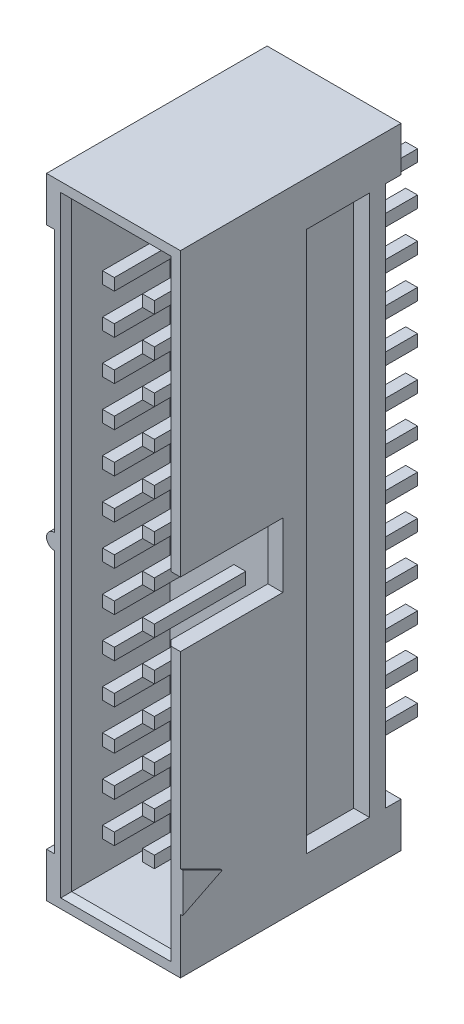
from build123d import *

# Parameters (mm, degrees)
SKETCH1_W            = 39.98
SKETCH1_H            = 13
BOSS_EXTRUDE1_DEPTH  = 8.5
SKETCH2_W            = 0.5
SKETCH2_H            = 37.15
CUT_EXTRUDE1_DEPTH   = 25.247888568
SKETCH3_W            = 8.5
SKETCH3_H            = 2.83
BOSS_EXTRUDE2_DEPTH  = 1
SKETCH4_W            = 13
SKETCH4_H            = 2.83
BOSS_EXTRUDE3_DEPTH  = 0.5
SKETCH5_W            = 8.5
SKETCH5_H            = 2.83
BOSS_EXTRUDE4_DEPTH  = 1
BOSS_EXTRUDE5_DEPTH  = 8.1
SKETCH7_W            = 4.9
SKETCH7_H            = 34.32
CUT_EXTRUDE2_DEPTH   = 0.5
SKETCH8_W            = 6.5
SKETCH8_H            = 34.1
BOSS_EXTRUDE6_DEPTH  = 1
SKETCH9_W            = 0.5
SKETCH9_H            = 0.04
CUT_EXTRUDE3_DEPTH   = 6.5
SKETCH10_W           = 0.5
SKETCH10_H           = 1.54
CUT_EXTRUDE4_DEPTH   = 26.531355232
SKETCH11_W           = 0.5
SKETCH11_H           = 1.54
CUT_EXTRUDE5_DEPTH   = 26.531355232
SKETCH12_W           = 0.5
SKETCH12_H           = 1.54
CUT_EXTRUDE6_DEPTH   = 26.531355232
SKETCH13_W           = 0.5
SKETCH13_H           = 1.54
CUT_EXTRUDE7_DEPTH   = 26.531355232
SKETCH14_W           = 0.5
SKETCH14_H           = 1.54
CUT_EXTRUDE8_DEPTH   = 26.531355232
SKETCH15_W           = 0.5
SKETCH15_H           = 1.54
CUT_EXTRUDE9_DEPTH   = 26.531355232
SKETCH16_W           = 0.5
SKETCH16_H           = 1.54
CUT_EXTRUDE10_DEPTH  = 26.531355232
SKETCH17_W           = 0.5
SKETCH17_H           = 1.54
CUT_EXTRUDE11_DEPTH  = 26.531355232
SKETCH18_W           = 0.5
SKETCH18_H           = 1.54
CUT_EXTRUDE12_DEPTH  = 26.531355232
SKETCH19_W           = 0.5
SKETCH19_H           = 1.54
CUT_EXTRUDE13_DEPTH  = 26.531355232
SKETCH20_W           = 0.5
SKETCH20_H           = 1.54
CUT_EXTRUDE14_DEPTH  = 26.531355232
SKETCH21_W           = 0.5
SKETCH21_H           = 1.54
CUT_EXTRUDE15_DEPTH  = 26.531355232
SKETCH22_W           = 0.5
SKETCH22_H           = 1.54
CUT_EXTRUDE16_DEPTH  = 26.531355232
SKETCH23_W           = 0.5
SKETCH23_H           = 0.04
CUT_EXTRUDE17_DEPTH  = 6.5
SKETCH24_W           = 6.3
SKETCH24_H           = 38.08
CUT_EXTRUDE18_DEPTH  = 6.6
CUT_EXTRUDE19_REACH  = 27.843
SKETCH25_W           = 6.5
SKETCH25_H           = 4.1
BOSS_EXTRUDE7_DEPTH  = 0.15
SKETCH27_W           = 0.75
SKETCH27_H           = 0.75
BOSS_EXTRUDE8_DEPTH  = 4
SKETCH28_W           = 0.75
SKETCH28_H           = 0.75
BOSS_EXTRUDE9_DEPTH  = 4
SKETCH29_W           = 0.75
SKETCH29_H           = 0.75
BOSS_EXTRUDE10_DEPTH = 4
SKETCH30_W           = 0.75
SKETCH30_H           = 0.75
BOSS_EXTRUDE11_DEPTH = 4
SKETCH31_W           = 0.75
SKETCH31_H           = 0.75
BOSS_EXTRUDE12_DEPTH = 4
SKETCH32_W           = 0.75
SKETCH32_H           = 0.75
BOSS_EXTRUDE13_DEPTH = 4
SKETCH33_W           = 0.75
SKETCH33_H           = 0.75
BOSS_EXTRUDE14_DEPTH = 4
SKETCH34_W           = 0.75
SKETCH34_H           = 0.75
BOSS_EXTRUDE15_DEPTH = 4
SKETCH35_W           = 0.75
SKETCH35_H           = 0.75
BOSS_EXTRUDE16_DEPTH = 4
SKETCH36_W           = 0.75
SKETCH36_H           = 0.75
BOSS_EXTRUDE17_DEPTH = 4
SKETCH37_W           = 0.75
SKETCH37_H           = 0.75
BOSS_EXTRUDE18_DEPTH = 4
SKETCH38_W           = 0.75
SKETCH38_H           = 0.75
BOSS_EXTRUDE19_DEPTH = 4
SKETCH39_W           = 0.75
SKETCH39_H           = 0.75
BOSS_EXTRUDE20_DEPTH = 4
SKETCH40_W           = 0.75
SKETCH40_H           = 0.75
BOSS_EXTRUDE21_DEPTH = 4
SKETCH41_W           = 0.75
SKETCH41_H           = 0.75
BOSS_EXTRUDE22_DEPTH = 4
SKETCH42_W           = 0.75
SKETCH42_H           = 0.75
BOSS_EXTRUDE23_DEPTH = 4
SKETCH43_W           = 0.75
SKETCH43_H           = 0.75
BOSS_EXTRUDE24_DEPTH = 4
SKETCH44_W           = 0.75
SKETCH44_H           = 0.75
BOSS_EXTRUDE25_DEPTH = 4
SKETCH45_W           = 0.75
SKETCH45_H           = 0.75
BOSS_EXTRUDE26_DEPTH = 4
SKETCH46_W           = 0.75
SKETCH46_H           = 0.75
BOSS_EXTRUDE27_DEPTH = 4
SKETCH47_W           = 0.75
SKETCH47_H           = 0.75
BOSS_EXTRUDE28_DEPTH = 4
SKETCH48_W           = 0.75
SKETCH48_H           = 0.75
BOSS_EXTRUDE29_DEPTH = 4
SKETCH49_W           = 0.75
SKETCH49_H           = 0.75
BOSS_EXTRUDE30_DEPTH = 4
SKETCH50_W           = 0.75
SKETCH50_H           = 0.75
BOSS_EXTRUDE31_DEPTH = 4
SKETCH51_W           = 0.75
SKETCH51_H           = 0.75
BOSS_EXTRUDE32_DEPTH = 4
SKETCH52_W           = 0.75
SKETCH52_H           = 0.75
BOSS_EXTRUDE33_DEPTH = 4
SKETCH53_W           = 0.75
SKETCH53_H           = 0.75
BOSS_EXTRUDE34_DEPTH = 5.8
SKETCH54_W           = 0.75
SKETCH54_H           = 0.75
BOSS_EXTRUDE35_DEPTH = 5.8
SKETCH55_W           = 0.75
SKETCH55_H           = 0.75
BOSS_EXTRUDE36_DEPTH = 5.8
SKETCH56_W           = 0.75
SKETCH56_H           = 0.75
BOSS_EXTRUDE37_DEPTH = 5.8
SKETCH57_W           = 0.75
SKETCH57_H           = 0.75
BOSS_EXTRUDE38_DEPTH = 5.8
SKETCH58_W           = 0.75
SKETCH58_H           = 0.75
BOSS_EXTRUDE39_DEPTH = 5.8
SKETCH59_W           = 0.75
SKETCH59_H           = 0.75
BOSS_EXTRUDE40_DEPTH = 5.8
SKETCH60_W           = 0.75
SKETCH60_H           = 0.75
BOSS_EXTRUDE41_DEPTH = 5.8
SKETCH61_W           = 0.75
SKETCH61_H           = 0.75
BOSS_EXTRUDE42_DEPTH = 5.8
SKETCH62_W           = 0.75
SKETCH62_H           = 0.75
BOSS_EXTRUDE43_DEPTH = 5.8
SKETCH63_W           = 0.75
SKETCH63_H           = 0.75
BOSS_EXTRUDE44_DEPTH = 5.8
SKETCH64_W           = 0.75
SKETCH64_H           = 0.75
BOSS_EXTRUDE45_DEPTH = 5.8
SKETCH65_W           = 0.75
SKETCH65_H           = 0.75
BOSS_EXTRUDE46_DEPTH = 5.8
SKETCH66_W           = 0.75
SKETCH66_H           = 0.75
BOSS_EXTRUDE47_DEPTH = 5.8
SKETCH67_W           = 0.75
SKETCH67_H           = 0.75
BOSS_EXTRUDE48_DEPTH = 5.8
SKETCH68_W           = 0.75
SKETCH68_H           = 0.75
BOSS_EXTRUDE49_DEPTH = 5.8
SKETCH69_W           = 0.75
SKETCH69_H           = 0.75
BOSS_EXTRUDE50_DEPTH = 5.8
SKETCH70_W           = 0.75
SKETCH70_H           = 0.75
BOSS_EXTRUDE51_DEPTH = 5.8
SKETCH71_W           = 0.75
SKETCH71_H           = 0.75
BOSS_EXTRUDE52_DEPTH = 5.8
SKETCH72_W           = 0.75
SKETCH72_H           = 0.75
BOSS_EXTRUDE53_DEPTH = 5.8
SKETCH73_W           = 0.75
SKETCH73_H           = 0.75
BOSS_EXTRUDE54_DEPTH = 5.8
SKETCH74_W           = 0.75
SKETCH74_H           = 0.75
BOSS_EXTRUDE55_DEPTH = 5.8
SKETCH75_W           = 0.75
SKETCH75_H           = 0.75
BOSS_EXTRUDE56_DEPTH = 5.8
SKETCH76_W           = 0.75
SKETCH76_H           = 0.75
BOSS_EXTRUDE57_DEPTH = 5.8
SKETCH77_W           = 0.75
SKETCH77_H           = 0.75
BOSS_EXTRUDE58_DEPTH = 5.8
SKETCH78_W           = 0.75
SKETCH78_H           = 0.75
BOSS_EXTRUDE59_DEPTH = 5.8
SKETCH79_W           = 4
SKETCH79_H           = 34.32
CUT_EXTRUDE20_DEPTH  = 1
CHAMFER1_SIZE        = 0.35


with BuildPart() as part:
    # Sketch1 → Boss-Extrude1 (new body)
    with BuildSketch(Plane(origin=(-4.4, 0, 0), x_dir=(0, -1, 0), z_dir=(-1, 0, 0))):
        with Locations((0, 7.5)):
            Rectangle(SKETCH1_W, SKETCH1_H)
    extrude(amount=-BOSS_EXTRUDE1_DEPTH)

    # Sketch2 → Cut-Extrude1 (cut, through all)
    with BuildSketch(Plane.XY.offset(14)):
        with Locations((-4.15, -1.415)):
            Rectangle(SKETCH2_W, SKETCH2_H)
    extrude(amount=-CUT_EXTRUDE1_DEPTH, mode=Mode.SUBTRACT)

    # Sketch3 → Boss-Extrude2 (add)
    with BuildSketch(Plane(origin=(0, 0, 1), x_dir=(-1, 0, 0), z_dir=(0, 0, -1))):
        with Locations((0.15, 18.575)):
            Rectangle(SKETCH3_W, SKETCH3_H)
    extrude(amount=BOSS_EXTRUDE2_DEPTH)

    # Sketch4 → Boss-Extrude3 (add)
    with BuildSketch(Plane.ZY.offset(3.9)):
        with Locations((7.5, -18.575)):
            Rectangle(SKETCH4_W, SKETCH4_H)
    extrude(amount=BOSS_EXTRUDE3_DEPTH)

    # Sketch5 → Boss-Extrude4 (add)
    with BuildSketch(Plane(origin=(0, 0, 1), x_dir=(-1, 0, 0), z_dir=(0, 0, -1))):
        with Locations((0.15, -18.575)):
            Rectangle(SKETCH5_W, SKETCH5_H)
    extrude(amount=BOSS_EXTRUDE4_DEPTH)

    # Sketch6 → Boss-Extrude5 (add)
    with BuildSketch(Plane.XY.offset(14)):
        with BuildLine():
            Line((-3.9, -0.5), (-3.9, 0.5))
            ThreePointArc((-3.9, 0.5), (-4.4, 0), (-3.9, -0.5))
        make_face()
    extrude(amount=-BOSS_EXTRUDE5_DEPTH)

    # Sketch7 → Cut-Extrude2 (cut)
    with BuildSketch(Plane.ZY.offset(3.9)):
        with Locations((3.45, 0)):
            Rectangle(SKETCH7_W, SKETCH7_H)
    extrude(amount=-CUT_EXTRUDE2_DEPTH, mode=Mode.SUBTRACT)

    # Sketch8 → Boss-Extrude6 (add)
    with BuildSketch(Plane(origin=(0, 0, 1), x_dir=(-1, 0, 0), z_dir=(0, 0, -1))):
        with Locations((0.15, 0)):
            Rectangle(SKETCH8_W, SKETCH8_H)
    extrude(amount=BOSS_EXTRUDE6_DEPTH)

    # Sketch9 → Cut-Extrude3 (cut)
    with BuildSketch(Plane.ZY.offset(3.4)):
        with Locations((0.25, -17.03)):
            Rectangle(SKETCH9_W, SKETCH9_H)
    extrude(amount=-CUT_EXTRUDE3_DEPTH, mode=Mode.SUBTRACT)

    # Sketch10 → Cut-Extrude4 (cut, through all)
    with BuildSketch(Plane.ZY.offset(3.4)):
        with Locations((0.25, -15.24)):
            Rectangle(SKETCH10_W, SKETCH10_H)
    extrude(amount=-CUT_EXTRUDE4_DEPTH, mode=Mode.SUBTRACT)

    # Sketch11 → Cut-Extrude5 (cut, through all)
    with BuildSketch(Plane.ZY.offset(3.4)):
        with Locations((0.25, -12.7)):
            Rectangle(SKETCH11_W, SKETCH11_H)
    extrude(amount=-CUT_EXTRUDE5_DEPTH, mode=Mode.SUBTRACT)

    # Sketch12 → Cut-Extrude6 (cut, through all)
    with BuildSketch(Plane.ZY.offset(3.4)):
        with Locations((0.25, -10.16)):
            Rectangle(SKETCH12_W, SKETCH12_H)
    extrude(amount=-CUT_EXTRUDE6_DEPTH, mode=Mode.SUBTRACT)

    # Sketch13 → Cut-Extrude7 (cut, through all)
    with BuildSketch(Plane.ZY.offset(3.4)):
        with Locations((0.25, -7.62)):
            Rectangle(SKETCH13_W, SKETCH13_H)
    extrude(amount=-CUT_EXTRUDE7_DEPTH, mode=Mode.SUBTRACT)

    # Sketch14 → Cut-Extrude8 (cut, through all)
    with BuildSketch(Plane.ZY.offset(3.4)):
        with Locations((0.25, -5.08)):
            Rectangle(SKETCH14_W, SKETCH14_H)
    extrude(amount=-CUT_EXTRUDE8_DEPTH, mode=Mode.SUBTRACT)

    # Sketch15 → Cut-Extrude9 (cut, through all)
    with BuildSketch(Plane.ZY.offset(3.4)):
        with Locations((0.25, -2.54)):
            Rectangle(SKETCH15_W, SKETCH15_H)
    extrude(amount=-CUT_EXTRUDE9_DEPTH, mode=Mode.SUBTRACT)

    # Sketch16 → Cut-Extrude10 (cut, through all)
    with BuildSketch(Plane.ZY.offset(3.4)):
        with Locations((0.25, 0)):
            Rectangle(SKETCH16_W, SKETCH16_H)
    extrude(amount=-CUT_EXTRUDE10_DEPTH, mode=Mode.SUBTRACT)

    # Sketch17 → Cut-Extrude11 (cut, through all)
    with BuildSketch(Plane.ZY.offset(3.4)):
        with Locations((0.25, 2.54)):
            Rectangle(SKETCH17_W, SKETCH17_H)
    extrude(amount=-CUT_EXTRUDE11_DEPTH, mode=Mode.SUBTRACT)

    # Sketch18 → Cut-Extrude12 (cut, through all)
    with BuildSketch(Plane.ZY.offset(3.4)):
        with Locations((0.25, 5.08)):
            Rectangle(SKETCH18_W, SKETCH18_H)
    extrude(amount=-CUT_EXTRUDE12_DEPTH, mode=Mode.SUBTRACT)

    # Sketch19 → Cut-Extrude13 (cut, through all)
    with BuildSketch(Plane.ZY.offset(3.4)):
        with Locations((0.25, 7.62)):
            Rectangle(SKETCH19_W, SKETCH19_H)
    extrude(amount=-CUT_EXTRUDE13_DEPTH, mode=Mode.SUBTRACT)

    # Sketch20 → Cut-Extrude14 (cut, through all)
    with BuildSketch(Plane.ZY.offset(3.4)):
        with Locations((0.25, 10.16)):
            Rectangle(SKETCH20_W, SKETCH20_H)
    extrude(amount=-CUT_EXTRUDE14_DEPTH, mode=Mode.SUBTRACT)

    # Sketch21 → Cut-Extrude15 (cut, through all)
    with BuildSketch(Plane.ZY.offset(3.4)):
        with Locations((0.25, 12.7)):
            Rectangle(SKETCH21_W, SKETCH21_H)
    extrude(amount=-CUT_EXTRUDE15_DEPTH, mode=Mode.SUBTRACT)

    # Sketch22 → Cut-Extrude16 (cut, through all)
    with BuildSketch(Plane.ZY.offset(3.4)):
        with Locations((0.25, 15.24)):
            Rectangle(SKETCH22_W, SKETCH22_H)
    extrude(amount=-CUT_EXTRUDE16_DEPTH, mode=Mode.SUBTRACT)

    # Sketch23 → Cut-Extrude17 (cut)
    with BuildSketch(Plane.ZY.offset(3.4)):
        with Locations((0.25, 17.03)):
            Rectangle(SKETCH23_W, SKETCH23_H)
    extrude(amount=-CUT_EXTRUDE17_DEPTH, mode=Mode.SUBTRACT)

    # Sketch24 → Cut-Extrude18 (cut)
    with BuildSketch(Plane.XY.offset(14)):
        Rectangle(SKETCH24_W, SKETCH24_H)
    extrude(amount=-CUT_EXTRUDE18_DEPTH, mode=Mode.SUBTRACT)

    # Sketch25 → Cut-Extrude19 (cut, up to next)
    with BuildSketch(Plane(origin=(4.1, 0, 0), x_dir=(0, 0, -1), z_dir=(1, 0, 0)), mode=Mode.PRIVATE) as cut_extrude19_sk1:
        with Locations((-10.75, 0)):
            Rectangle(SKETCH25_W, SKETCH25_H)
    cut_extrude19_tool1 = extrude(cut_extrude19_sk1.sketch, amount=-CUT_EXTRUDE19_REACH, mode=Mode.PRIVATE) & part.part
    add(cut_extrude19_tool1.solids().sort_by_distance((4.1, 0, 10.75))[0], mode=Mode.SUBTRACT)

    # Sketch26 → Boss-Extrude7 (add)
    with BuildSketch(Plane(origin=(4.1, 0, 0), x_dir=(0, 0, -1), z_dir=(1, 0, 0))):
        Polygon((-14, -13.99), (-11.5, -15.24), (-14, -16.49), align=None)
    extrude(amount=BOSS_EXTRUDE7_DEPTH)

    # Sketch27 → Boss-Extrude8 (add)
    with BuildSketch(Plane(origin=(0, 0, 0.5), x_dir=(-1, 0, 0), z_dir=(0, 0, -1))):
        with Locations((-1.27, 0)):
            Rectangle(SKETCH27_W, SKETCH27_H)
    extrude(amount=BOSS_EXTRUDE8_DEPTH)

    # Sketch28 → Boss-Extrude9 (add)
    with BuildSketch(Plane(origin=(0, 0, 0.5), x_dir=(-1, 0, 0), z_dir=(0, 0, -1))):
        with Locations((1.27, 0)):
            Rectangle(SKETCH28_W, SKETCH28_H)
    extrude(amount=BOSS_EXTRUDE9_DEPTH)

    # Sketch29 → Boss-Extrude10 (add)
    with BuildSketch(Plane(origin=(0, 0, 0.5), x_dir=(-1, 0, 0), z_dir=(0, 0, -1))):
        with Locations((-1.27, -2.54)):
            Rectangle(SKETCH29_W, SKETCH29_H)
    extrude(amount=BOSS_EXTRUDE10_DEPTH)

    # Sketch30 → Boss-Extrude11 (add)
    with BuildSketch(Plane(origin=(0, 0, 0.5), x_dir=(-1, 0, 0), z_dir=(0, 0, -1))):
        with Locations((1.27, -2.54)):
            Rectangle(SKETCH30_W, SKETCH30_H)
    extrude(amount=BOSS_EXTRUDE11_DEPTH)

    # Sketch31 → Boss-Extrude12 (add)
    with BuildSketch(Plane(origin=(0, 0, 0.5), x_dir=(-1, 0, 0), z_dir=(0, 0, -1))):
        with Locations((-1.27, 2.54)):
            Rectangle(SKETCH31_W, SKETCH31_H)
    extrude(amount=BOSS_EXTRUDE12_DEPTH)

    # Sketch32 → Boss-Extrude13 (add)
    with BuildSketch(Plane(origin=(0, 0, 0.5), x_dir=(-1, 0, 0), z_dir=(0, 0, -1))):
        with Locations((1.27, 2.54)):
            Rectangle(SKETCH32_W, SKETCH32_H)
    extrude(amount=BOSS_EXTRUDE13_DEPTH)

    # Sketch33 → Boss-Extrude14 (add)
    with BuildSketch(Plane(origin=(0, 0, 0.5), x_dir=(-1, 0, 0), z_dir=(0, 0, -1))):
        with Locations((-1.27, -5.08)):
            Rectangle(SKETCH33_W, SKETCH33_H)
    extrude(amount=BOSS_EXTRUDE14_DEPTH)

    # Sketch34 → Boss-Extrude15 (add)
    with BuildSketch(Plane(origin=(0, 0, 0.5), x_dir=(-1, 0, 0), z_dir=(0, 0, -1))):
        with Locations((1.27, -5.08)):
            Rectangle(SKETCH34_W, SKETCH34_H)
    extrude(amount=BOSS_EXTRUDE15_DEPTH)

    # Sketch35 → Boss-Extrude16 (add)
    with BuildSketch(Plane(origin=(0, 0, 0.5), x_dir=(-1, 0, 0), z_dir=(0, 0, -1))):
        with Locations((-1.27, 5.08)):
            Rectangle(SKETCH35_W, SKETCH35_H)
    extrude(amount=BOSS_EXTRUDE16_DEPTH)

    # Sketch36 → Boss-Extrude17 (add)
    with BuildSketch(Plane(origin=(0, 0, 0.5), x_dir=(-1, 0, 0), z_dir=(0, 0, -1))):
        with Locations((1.27, 5.08)):
            Rectangle(SKETCH36_W, SKETCH36_H)
    extrude(amount=BOSS_EXTRUDE17_DEPTH)

    # Sketch37 → Boss-Extrude18 (add)
    with BuildSketch(Plane(origin=(0, 0, 0.5), x_dir=(-1, 0, 0), z_dir=(0, 0, -1))):
        with Locations((-1.27, -7.62)):
            Rectangle(SKETCH37_W, SKETCH37_H)
    extrude(amount=BOSS_EXTRUDE18_DEPTH)

    # Sketch38 → Boss-Extrude19 (add)
    with BuildSketch(Plane(origin=(0, 0, 0.5), x_dir=(-1, 0, 0), z_dir=(0, 0, -1))):
        with Locations((1.27, -7.62)):
            Rectangle(SKETCH38_W, SKETCH38_H)
    extrude(amount=BOSS_EXTRUDE19_DEPTH)

    # Sketch39 → Boss-Extrude20 (add)
    with BuildSketch(Plane(origin=(0, 0, 0.5), x_dir=(-1, 0, 0), z_dir=(0, 0, -1))):
        with Locations((-1.27, 7.62)):
            Rectangle(SKETCH39_W, SKETCH39_H)
    extrude(amount=BOSS_EXTRUDE20_DEPTH)

    # Sketch40 → Boss-Extrude21 (add)
    with BuildSketch(Plane(origin=(0, 0, 0.5), x_dir=(-1, 0, 0), z_dir=(0, 0, -1))):
        with Locations((1.27, 7.62)):
            Rectangle(SKETCH40_W, SKETCH40_H)
    extrude(amount=BOSS_EXTRUDE21_DEPTH)

    # Sketch41 → Boss-Extrude22 (add)
    with BuildSketch(Plane(origin=(0, 0, 0.5), x_dir=(-1, 0, 0), z_dir=(0, 0, -1))):
        with Locations((-1.27, -10.16)):
            Rectangle(SKETCH41_W, SKETCH41_H)
    extrude(amount=BOSS_EXTRUDE22_DEPTH)

    # Sketch42 → Boss-Extrude23 (add)
    with BuildSketch(Plane(origin=(0, 0, 0.5), x_dir=(-1, 0, 0), z_dir=(0, 0, -1))):
        with Locations((1.27, -10.16)):
            Rectangle(SKETCH42_W, SKETCH42_H)
    extrude(amount=BOSS_EXTRUDE23_DEPTH)

    # Sketch43 → Boss-Extrude24 (add)
    with BuildSketch(Plane(origin=(0, 0, 0.5), x_dir=(-1, 0, 0), z_dir=(0, 0, -1))):
        with Locations((-1.27, 10.16)):
            Rectangle(SKETCH43_W, SKETCH43_H)
    extrude(amount=BOSS_EXTRUDE24_DEPTH)

    # Sketch44 → Boss-Extrude25 (add)
    with BuildSketch(Plane(origin=(0, 0, 0.5), x_dir=(-1, 0, 0), z_dir=(0, 0, -1))):
        with Locations((1.27, 10.16)):
            Rectangle(SKETCH44_W, SKETCH44_H)
    extrude(amount=BOSS_EXTRUDE25_DEPTH)

    # Sketch45 → Boss-Extrude26 (add)
    with BuildSketch(Plane(origin=(0, 0, 0.5), x_dir=(-1, 0, 0), z_dir=(0, 0, -1))):
        with Locations((-1.27, -12.7)):
            Rectangle(SKETCH45_W, SKETCH45_H)
    extrude(amount=BOSS_EXTRUDE26_DEPTH)

    # Sketch46 → Boss-Extrude27 (add)
    with BuildSketch(Plane(origin=(0, 0, 0.5), x_dir=(-1, 0, 0), z_dir=(0, 0, -1))):
        with Locations((1.27, -12.7)):
            Rectangle(SKETCH46_W, SKETCH46_H)
    extrude(amount=BOSS_EXTRUDE27_DEPTH)

    # Sketch47 → Boss-Extrude28 (add)
    with BuildSketch(Plane(origin=(0, 0, 0.5), x_dir=(-1, 0, 0), z_dir=(0, 0, -1))):
        with Locations((-1.27, 12.7)):
            Rectangle(SKETCH47_W, SKETCH47_H)
    extrude(amount=BOSS_EXTRUDE28_DEPTH)

    # Sketch48 → Boss-Extrude29 (add)
    with BuildSketch(Plane(origin=(0, 0, 0.5), x_dir=(-1, 0, 0), z_dir=(0, 0, -1))):
        with Locations((1.27, 12.7)):
            Rectangle(SKETCH48_W, SKETCH48_H)
    extrude(amount=BOSS_EXTRUDE29_DEPTH)

    # Sketch49 → Boss-Extrude30 (add)
    with BuildSketch(Plane(origin=(0, 0, 0.5), x_dir=(-1, 0, 0), z_dir=(0, 0, -1))):
        with Locations((-1.27, -15.24)):
            Rectangle(SKETCH49_W, SKETCH49_H)
    extrude(amount=BOSS_EXTRUDE30_DEPTH)

    # Sketch50 → Boss-Extrude31 (add)
    with BuildSketch(Plane(origin=(0, 0, 0.5), x_dir=(-1, 0, 0), z_dir=(0, 0, -1))):
        with Locations((1.27, -15.24)):
            Rectangle(SKETCH50_W, SKETCH50_H)
    extrude(amount=BOSS_EXTRUDE31_DEPTH)

    # Sketch51 → Boss-Extrude32 (add)
    with BuildSketch(Plane(origin=(0, 0, 0.5), x_dir=(-1, 0, 0), z_dir=(0, 0, -1))):
        with Locations((-1.27, 15.24)):
            Rectangle(SKETCH51_W, SKETCH51_H)
    extrude(amount=BOSS_EXTRUDE32_DEPTH)

    # Sketch52 → Boss-Extrude33 (add)
    with BuildSketch(Plane(origin=(0, 0, 0.5), x_dir=(-1, 0, 0), z_dir=(0, 0, -1))):
        with Locations((1.27, 15.24)):
            Rectangle(SKETCH52_W, SKETCH52_H)
    extrude(amount=BOSS_EXTRUDE33_DEPTH)

    # Sketch53 → Boss-Extrude34 (add)
    with BuildSketch(Plane.XY.offset(7.4)):
        with Locations((1.27, -15.24)):
            Rectangle(SKETCH53_W, SKETCH53_H)
    extrude(amount=BOSS_EXTRUDE34_DEPTH)

    # Sketch54 → Boss-Extrude35 (add)
    with BuildSketch(Plane.XY.offset(7.4)):
        with Locations((-1.27, -15.24)):
            Rectangle(SKETCH54_W, SKETCH54_H)
    extrude(amount=BOSS_EXTRUDE35_DEPTH)

    # Sketch55 → Boss-Extrude36 (add)
    with BuildSketch(Plane.XY.offset(7.4)):
        with Locations((1.27, -12.7)):
            Rectangle(SKETCH55_W, SKETCH55_H)
    extrude(amount=BOSS_EXTRUDE36_DEPTH)

    # Sketch56 → Boss-Extrude37 (add)
    with BuildSketch(Plane.XY.offset(7.4)):
        with Locations((-1.27, -12.7)):
            Rectangle(SKETCH56_W, SKETCH56_H)
    extrude(amount=BOSS_EXTRUDE37_DEPTH)

    # Sketch57 → Boss-Extrude38 (add)
    with BuildSketch(Plane.XY.offset(7.4)):
        with Locations((1.27, -10.16)):
            Rectangle(SKETCH57_W, SKETCH57_H)
    extrude(amount=BOSS_EXTRUDE38_DEPTH)

    # Sketch58 → Boss-Extrude39 (add)
    with BuildSketch(Plane.XY.offset(7.4)):
        with Locations((-1.27, -10.16)):
            Rectangle(SKETCH58_W, SKETCH58_H)
    extrude(amount=BOSS_EXTRUDE39_DEPTH)

    # Sketch59 → Boss-Extrude40 (add)
    with BuildSketch(Plane.XY.offset(7.4)):
        with Locations((1.27, -7.62)):
            Rectangle(SKETCH59_W, SKETCH59_H)
    extrude(amount=BOSS_EXTRUDE40_DEPTH)

    # Sketch60 → Boss-Extrude41 (add)
    with BuildSketch(Plane.XY.offset(7.4)):
        with Locations((-1.27, -7.62)):
            Rectangle(SKETCH60_W, SKETCH60_H)
    extrude(amount=BOSS_EXTRUDE41_DEPTH)

    # Sketch61 → Boss-Extrude42 (add)
    with BuildSketch(Plane.XY.offset(7.4)):
        with Locations((1.27, -5.08)):
            Rectangle(SKETCH61_W, SKETCH61_H)
    extrude(amount=BOSS_EXTRUDE42_DEPTH)

    # Sketch62 → Boss-Extrude43 (add)
    with BuildSketch(Plane.XY.offset(7.4)):
        with Locations((-1.27, -5.08)):
            Rectangle(SKETCH62_W, SKETCH62_H)
    extrude(amount=BOSS_EXTRUDE43_DEPTH)

    # Sketch63 → Boss-Extrude44 (add)
    with BuildSketch(Plane.XY.offset(7.4)):
        with Locations((1.27, -2.54)):
            Rectangle(SKETCH63_W, SKETCH63_H)
    extrude(amount=BOSS_EXTRUDE44_DEPTH)

    # Sketch64 → Boss-Extrude45 (add)
    with BuildSketch(Plane.XY.offset(7.4)):
        with Locations((-1.27, -2.54)):
            Rectangle(SKETCH64_W, SKETCH64_H)
    extrude(amount=BOSS_EXTRUDE45_DEPTH)

    # Sketch65 → Boss-Extrude46 (add)
    with BuildSketch(Plane.XY.offset(7.4)):
        with Locations((1.27, 0)):
            Rectangle(SKETCH65_W, SKETCH65_H)
    extrude(amount=BOSS_EXTRUDE46_DEPTH)

    # Sketch66 → Boss-Extrude47 (add)
    with BuildSketch(Plane.XY.offset(7.4)):
        with Locations((-1.27, 0)):
            Rectangle(SKETCH66_W, SKETCH66_H)
    extrude(amount=BOSS_EXTRUDE47_DEPTH)

    # Sketch67 → Boss-Extrude48 (add)
    with BuildSketch(Plane.XY.offset(7.4)):
        with Locations((1.27, 2.54)):
            Rectangle(SKETCH67_W, SKETCH67_H)
    extrude(amount=BOSS_EXTRUDE48_DEPTH)

    # Sketch68 → Boss-Extrude49 (add)
    with BuildSketch(Plane.XY.offset(7.4)):
        with Locations((-1.27, 2.54)):
            Rectangle(SKETCH68_W, SKETCH68_H)
    extrude(amount=BOSS_EXTRUDE49_DEPTH)

    # Sketch69 → Boss-Extrude50 (add)
    with BuildSketch(Plane.XY.offset(7.4)):
        with Locations((1.27, 5.08)):
            Rectangle(SKETCH69_W, SKETCH69_H)
    extrude(amount=BOSS_EXTRUDE50_DEPTH)

    # Sketch70 → Boss-Extrude51 (add)
    with BuildSketch(Plane.XY.offset(7.4)):
        with Locations((-1.27, 5.08)):
            Rectangle(SKETCH70_W, SKETCH70_H)
    extrude(amount=BOSS_EXTRUDE51_DEPTH)

    # Sketch71 → Boss-Extrude52 (add)
    with BuildSketch(Plane.XY.offset(7.4)):
        with Locations((1.27, 7.62)):
            Rectangle(SKETCH71_W, SKETCH71_H)
    extrude(amount=BOSS_EXTRUDE52_DEPTH)

    # Sketch72 → Boss-Extrude53 (add)
    with BuildSketch(Plane.XY.offset(7.4)):
        with Locations((-1.27, 7.62)):
            Rectangle(SKETCH72_W, SKETCH72_H)
    extrude(amount=BOSS_EXTRUDE53_DEPTH)

    # Sketch73 → Boss-Extrude54 (add)
    with BuildSketch(Plane.XY.offset(7.4)):
        with Locations((1.27, 10.16)):
            Rectangle(SKETCH73_W, SKETCH73_H)
    extrude(amount=BOSS_EXTRUDE54_DEPTH)

    # Sketch74 → Boss-Extrude55 (add)
    with BuildSketch(Plane.XY.offset(7.4)):
        with Locations((-1.27, 10.16)):
            Rectangle(SKETCH74_W, SKETCH74_H)
    extrude(amount=BOSS_EXTRUDE55_DEPTH)

    # Sketch75 → Boss-Extrude56 (add)
    with BuildSketch(Plane.XY.offset(7.4)):
        with Locations((1.27, 12.7)):
            Rectangle(SKETCH75_W, SKETCH75_H)
    extrude(amount=BOSS_EXTRUDE56_DEPTH)

    # Sketch76 → Boss-Extrude57 (add)
    with BuildSketch(Plane.XY.offset(7.4)):
        with Locations((-1.27, 12.7)):
            Rectangle(SKETCH76_W, SKETCH76_H)
    extrude(amount=BOSS_EXTRUDE57_DEPTH)

    # Sketch77 → Boss-Extrude58 (add)
    with BuildSketch(Plane.XY.offset(7.4)):
        with Locations((1.27, 15.24)):
            Rectangle(SKETCH77_W, SKETCH77_H)
    extrude(amount=BOSS_EXTRUDE58_DEPTH)

    # Sketch78 → Boss-Extrude59 (add)
    with BuildSketch(Plane.XY.offset(7.4)):
        with Locations((-1.27, 15.24)):
            Rectangle(SKETCH78_W, SKETCH78_H)
    extrude(amount=BOSS_EXTRUDE59_DEPTH)

    # Sketch79 → Cut-Extrude20 (cut)
    with BuildSketch(Plane(origin=(4.1, 0, 0), x_dir=(0, 0, -1), z_dir=(1, 0, 0))):
        with Locations((-4, 0)):
            Rectangle(SKETCH79_W, SKETCH79_H)
    extrude(amount=-CUT_EXTRUDE20_DEPTH, mode=Mode.SUBTRACT)

    # Chamfer1
    chamfer1_edges = [part.edges().sort_by_distance(p)[0] for p in [
        (3.15, -10.545, 14),
        (0, -19.04, 14),
        (-3.15, 0, 14),
        (3.15, 10.545, 14),
        (0, 19.04, 14),
    ]]
    chamfer(chamfer1_edges, length=CHAMFER1_SIZE)


solid = part.part
